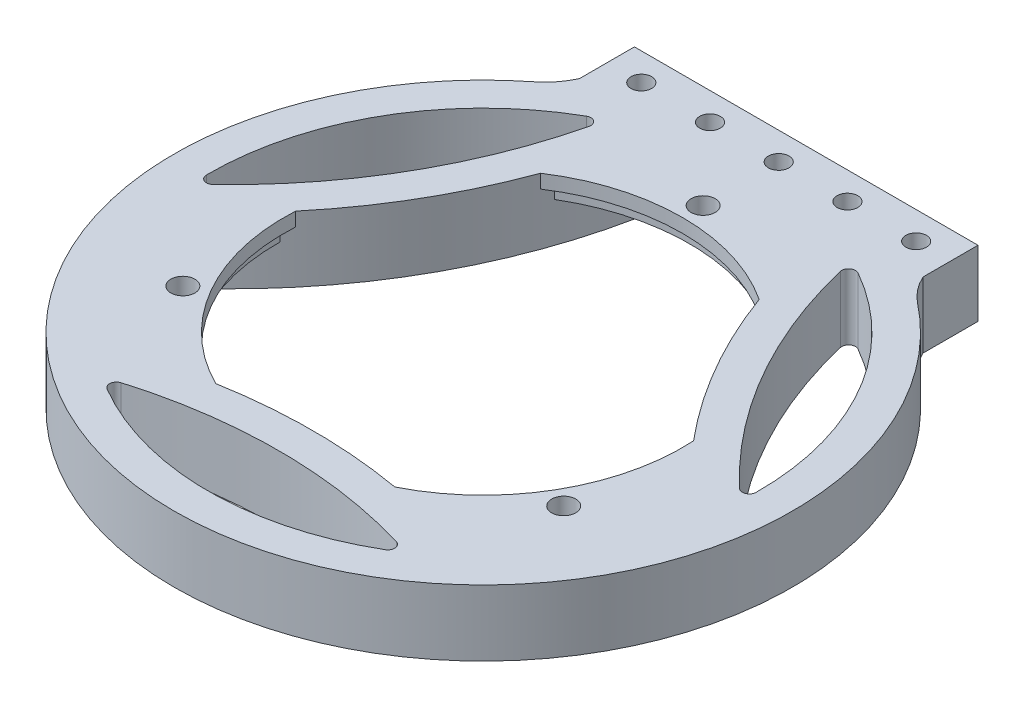
from build123d import *

# Parameters (mm, degrees)
SKETCH1_R                = 37.5
BOSS_EXTRUDE1_DEPTH      = 7.6
CUT_EXTRUDE2_START       = -7.6
CUT_EXTRUDE2_DEPTH       = 7.6
SKETCH4_R                = 45
SKETCH4_R_2              = 37.5
BOSS_EXTRUDE2_DEPTH      = 7.6
SKETCH6_R                = 45
BOSS_EXTRUDE3_DEPTH      = 2
SKETCH7_R                = 1.75
CUT_EXTRUDE3_DEPTH       = 65.359614666
CIRPATTERN2_COUNT        = 3
BOSS_EXTRUDE4_START      = -9.6
BOSS_EXTRUDE4_DEPTH      = 9.6
FILLET1_R                = 10
SKETCH12_R               = 1.5
CUT_EXTRUDE6_DEPTH       = 66.773550915
LPATTERN1_COUNT          = 10
LPATTERN1_PITCH          = 10
CUT_EXTRUDE7_DEPTH       = 66.773550915
FILLET3_R                = 1
CIRPATTERN3_COUNT        = 3
FILLET3_OF_CIRPATTERN3_R = 1
BOSS_EXTRUDE5_START      = 1.8
SKETCH14_R               = 1.75
BOSS_EXTRUDE5_DEPTH      = 1.8
CIRPATTERN4_COUNT        = 3


# Read off the part's stored shape, not the designer's step: Cut-Extrude2
with BuildPart() as part:
    # Sketch1 → Boss-Extrude1 (new body)
    with BuildSketch(Plane(origin=(0, 0, 0), x_dir=(1, 0, 0), z_dir=(0, 1, 0))):
        with Locations(Location((0, 0, 0), (0, 0, 90))):
            Circle(SKETCH1_R)
    extrude(amount=BOSS_EXTRUDE1_DEPTH)

    # Cut-Extrude2 outline → Cut-Extrude2 (cut)
    with BuildSketch(Plane(origin=(0, 7.6, 0), x_dir=(1, 0, 0), z_dir=(0, 1, 0)).offset(CUT_EXTRUDE2_START)):
        with BuildLine():
            ThreePointArc((-24.104535363, -28.726666617), (0, -24.760936498), (24.104535363, -28.726666617))
            ThreePointArc((24.104535363, -28.726666617), (32.475952642, -18.75), (36.930290738, -6.511806663))
            ThreePointArc((36.930290738, -6.511806663), (21.443600029, 12.380468249), (12.825755375, 35.238473279))
            ThreePointArc((12.825755375, 35.238473279), (0, 37.5), (-12.825755375, 35.238473279))
            ThreePointArc((-12.825755375, 35.238473279), (-21.443600029, 12.380468249), (-36.930290738, -6.511806663))
            ThreePointArc((-36.930290738, -6.511806663), (-32.475952642, -18.75), (-24.104535363, -28.726666617))
        make_face()
    extrude(amount=CUT_EXTRUDE2_DEPTH, mode=Mode.SUBTRACT)

    # Sketch4 → Boss-Extrude2 (add)
    with BuildSketch(Plane(origin=(0, 0, 0), x_dir=(1, 0, 0), z_dir=(0, 1, 0))):
        with Locations(Location((0, 0, 0), (0, 0, 90))):
            Circle(SKETCH4_R)
        Circle(SKETCH4_R_2, mode=Mode.SUBTRACT)
    extrude(amount=BOSS_EXTRUDE2_DEPTH)

    # Sketch6 → Boss-Extrude3 (add)
    with BuildSketch(Plane(origin=(0, 7.6, 0), x_dir=(1, 0, 0), z_dir=(0, 1, 0))):
        with Locations(Location((0, 0, 0), (0, 0, 90))):
            Circle(SKETCH6_R)
        with BuildLine():
            ThreePointArc((-28.952849653, 1.653026611), (-25.11473671, -14.5), (-13.044861788, -25.900416617))
            ThreePointArc((-13.044861788, -25.900416617), (0, -24.760936498), (13.044861788, -25.900416617))
            ThreePointArc((13.044861788, -25.900416617), (25.11473671, -14.5), (28.952849653, 1.653026611))
            ThreePointArc((28.952849653, 1.653026611), (21.443600029, 12.380468249), (15.907987865, 24.247390006))
            ThreePointArc((15.907987865, 24.247390006), (0, 29), (-15.907987865, 24.247390006))
            ThreePointArc((-15.907987865, 24.247390006), (-21.443600029, 12.380468249), (-28.952849653, 1.653026611))
        make_face(mode=Mode.SUBTRACT)
    extrude(amount=BOSS_EXTRUDE3_DEPTH)

    # Sketch7 → Cut-Extrude3 (cut, through all)
    with BuildSketch(Plane(origin=(0, 9.6, 0), x_dir=(1, 0, 0), z_dir=(0, 1, 0))):
        with Locations(Location((0, 32, 0), (0, 0, 270))):
            Circle(SKETCH7_R)
    cut_extrude3 = extrude(amount=-CUT_EXTRUDE3_DEPTH, mode=Mode.SUBTRACT)

    # CirPattern2: Cut-Extrude3 ×3 about axis
    cirpattern2_axis = Axis((0, 0, 0), (0, 1, 0))
    for i in range(1, CIRPATTERN2_COUNT):
        add(cut_extrude3.rotate(cirpattern2_axis, i * 360 / CIRPATTERN2_COUNT), mode=Mode.SUBTRACT)

    # Sketch11 → Boss-Extrude4 (add)
    with BuildSketch(Plane(origin=(0, 9.6, 0), x_dir=(1, 0, 0), z_dir=(0, 1, 0)).offset(BOSS_EXTRUDE4_START)):
        with BuildLine():
            ThreePointArc((-22.449944321, 39), (0, 45), (22.449944321, 39))
            Line((22.449944321, 39), (25, 39))
            Line((25, 39), (25, 47))
            Line((25, 47), (-25, 47))
            Line((-25, 47), (-25, 39))
            Line((-25, 39), (-22.449944321, 39))
        make_face()
    extrude(amount=BOSS_EXTRUDE4_DEPTH)

    # Fillet1
    # the kernel refuses this fillet: 10 mm, written as the material it adds along each edge
    with BuildSketch(Plane(origin=(-22.449944321, 0, -39), x_dir=(-0.8278845523725272, 0, 0.5608985362282026), z_dir=(0, 1, 0))) as fillet1_piece_1:
        with BuildLine():
            CenterArc((7.309068463, -9.973252989), FILLET1_R, 94.191525444, 27.126753117)
            Line((2.111151705, -1.430322498), (0, 0))
            ThreePointArc((0, 0), (3.289080808, -0.12036155), (6.578161616, 0))
        make_face()
    extrude(amount=9.6)
    with BuildSketch(Plane(origin=(22.449944321, 0, -39), x_dir=(0.8278845523725283, 0, 0.560898536228201), z_dir=(0, 1, 0))) as fillet1_piece_2:
        with BuildLine():
            CenterArc((7.309068463, 9.973252989), FILLET1_R, 238.681721439, 27.126753117)
            Line((2.111151705, 1.430322498), (0, 0))
            ThreePointArc((0, 0), (3.289080808, 0.12036155), (6.578161616, 0))
        make_face()
    extrude(amount=9.6)

    # Sketch12 → Cut-Extrude6 (cut, through all)
    with BuildSketch(Plane.XZ):
        with Locations(Location((-20, -43, 0), (0, 0, 270))):
            Circle(SKETCH12_R)
    cut_extrude6 = extrude(amount=-CUT_EXTRUDE6_DEPTH, mode=Mode.SUBTRACT)

    # LPattern1: Cut-Extrude6 ×10
    with Locations(*[(i * LPATTERN1_PITCH, 0, 0) for i in range(1, LPATTERN1_COUNT)]):
        add(cut_extrude6, mode=Mode.SUBTRACT)

    # Sketch13 → Cut-Extrude7 (cut, through all)
    with BuildSketch(Plane.XZ):
        with BuildLine():
            ThreePointArc((-22.11228446, 33.332369792), (0, 29.760936498), (22.11228446, 33.332369792))
            ThreePointArc((22.11228446, 33.332369792), (0, 40), (-22.11228446, 33.332369792))
        make_face()
    cut_extrude7 = extrude(amount=-CUT_EXTRUDE7_DEPTH, mode=Mode.SUBTRACT)

    # Fillet3
    fillet3_edges = [part.edges().sort_by_distance(p)[0] for p in [
        (-22.11228446, 4.8, 33.332369792),
        (22.11228446, 4.8, 33.332369792),
    ]]
    fillet(fillet3_edges, radius=FILLET3_R)

    # CirPattern3: Cut-Extrude7 ×3 about axis
    cirpattern3_axis = Axis((0, 0, 0), (0, 1, 0))
    for i in range(1, CIRPATTERN3_COUNT):
        add(cut_extrude7.rotate(cirpattern3_axis, i * 360 / CIRPATTERN3_COUNT), mode=Mode.SUBTRACT)

    # Fillet3 of CirPattern3
    fillet3_of_cirpattern3_edges = [part.edges().sort_by_distance(p)[0] for p in [
        (39.922821238, 4.8, 2.483615182),
        (17.810536778, 4.8, -35.815984974),
        (-17.810536778, 4.8, -35.815984974),
        (-39.922821238, 4.8, 2.483615182),
    ]]
    fillet(fillet3_of_cirpattern3_edges, radius=FILLET3_OF_CIRPATTERN3_R)

    # Sketch14 → Boss-Extrude5 (add)
    with BuildSketch(Plane.XZ.offset(-7.6).offset(BOSS_EXTRUDE5_START)):
        with BuildLine():
            ThreePointArc((-15.374943027, -25.760650747), (0, -30), (15.374943027, -25.760650747))
            ThreePointArc((15.374943027, -25.760650747), (13.94564115, -30.457951205), (12.825755375, -35.238473279))
            ThreePointArc((12.825755375, -35.238473279), (0, -37.5), (-12.825755375, -35.238473279))
            ThreePointArc((-12.825755375, -35.238473279), (-13.94564115, -30.457951205), (-15.374943027, -25.760650747))
        make_face()
        with Locations(Location((0, -32, 0), (0, 0, 90))):
            Circle(SKETCH14_R, mode=Mode.SUBTRACT)
    boss_extrude5 = extrude(amount=-BOSS_EXTRUDE5_DEPTH)

    # CirPattern4: Boss-Extrude5 ×3 about axis
    cirpattern4_axis = Axis((0, 7.6, 0), (0, -1, 0))
    for i in range(1, CIRPATTERN4_COUNT):
        add(boss_extrude5.rotate(cirpattern4_axis, i * 360 / CIRPATTERN4_COUNT))


solid = part.part
